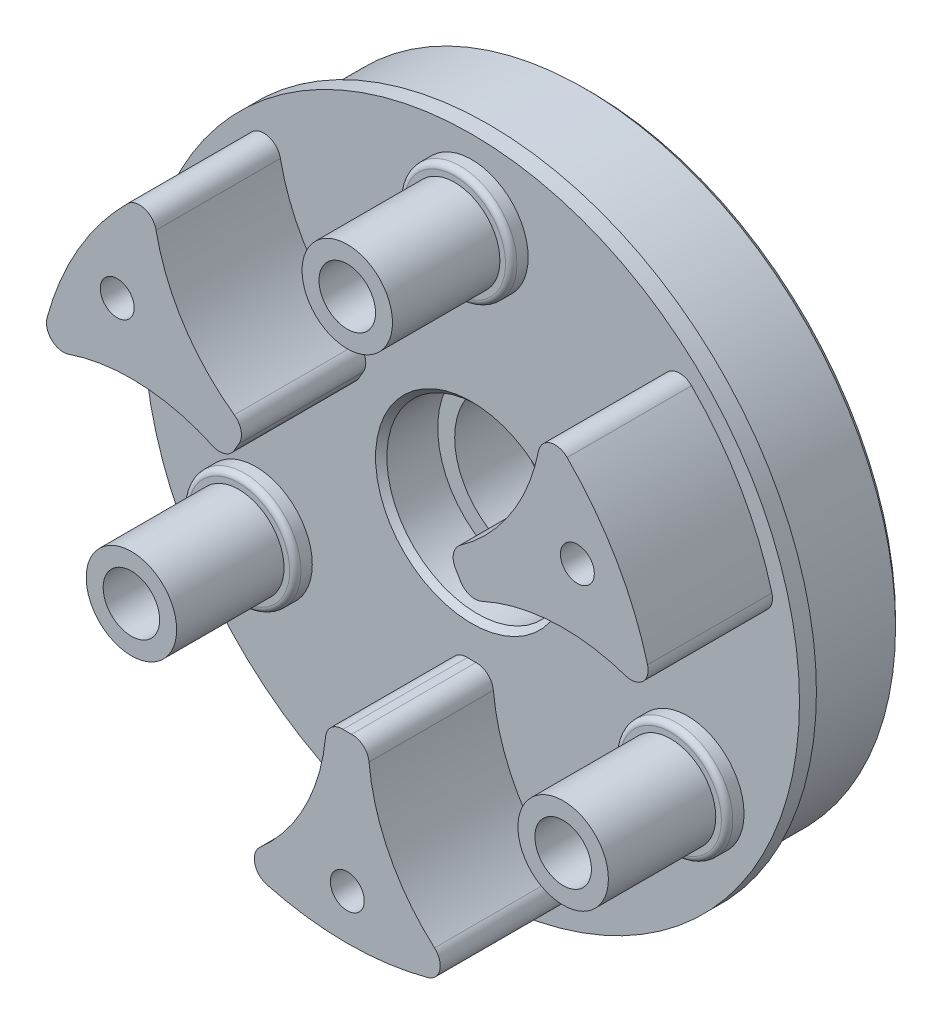
from build123d import *

# Parameters (mm, degrees)
SKETCH1_R                = 27.5
SKETCH1_R_2              = 2.5
BOSS_EXTRUDE1_DEPTH      = 10.5
SKETCH2_R                = 4
SKETCH2_R_2              = 2.5
BOSS_EXTRUDE2_DEPTH      = 11
SKETCH3_R                = 5
SKETCH3_R_2              = 4
BOSS_EXTRUDE3_DEPTH      = 1.5
BOSS_EXTRUDE4_DEPTH      = 11
FILLET2_R                = 0.5
FILLET5_R                = 1.5
CIRPATTERN1_COUNT        = 3
FILLET2_OF_CIRPATTERN1_R = 0.5
FILLET5_OF_CIRPATTERN1_R = 1.5
SKETCH5_R                = 1.5
CUT_EXTRUDE1_DEPTH       = 45.438159278
SKETCH6_R                = 2.75
CUT_EXTRUDE2_DEPTH       = 3
SKETCH7_R                = 4.25
CUT_EXTRUDE3_DEPTH       = 5
CIRPATTERN2_COUNT        = 3
CHAMFER1_SIZE            = 0.5
SKETCH9_R                = 8
CUT_EXTRUDE4_DEPTH       = 41.416580756
BOSS_EXTRUDE7_START      = -5.5
SKETCH10_R               = 8
SKETCH10_R_2             = 6.5
BOSS_EXTRUDE7_DEPTH      = 5.5
CHAMFER2_SIZE            = 0.5
BOSS_EXTRUDE8_START      = -1.5
SKETCH11_R               = 29
SKETCH11_R_2             = 27.5
BOSS_EXTRUDE8_DEPTH      = 1.5


with BuildPart() as part:
    # Sketch1 → Boss-Extrude1 (new body)
    with BuildSketch(Plane.XY):
        with Locations(Location((0, 0, 0), (0, 0, 180))):
            Circle(SKETCH1_R)
        with Locations(Location((0, 22.05, 0), (0, 0, 180))):
            Circle(SKETCH1_R_2, mode=Mode.SUBTRACT)
        with Locations(Location((19.095860153, -11.025, 0), (0, 0, 180))):
            Circle(SKETCH1_R_2, mode=Mode.SUBTRACT)
        with Locations(Location((-19.095860153, -11.025, 0), (0, 0, 180))):
            Circle(SKETCH1_R_2, mode=Mode.SUBTRACT)
    extrude(amount=BOSS_EXTRUDE1_DEPTH)

    # Sketch2 → Boss-Extrude2 (add)
    with BuildSketch(Plane.XY.offset(10.5)):
        with Locations((0, 22.05)):
            Circle(SKETCH2_R)
        with Locations(Location((0, 22.05, 0), (0, 0, 180))):
            Circle(SKETCH2_R_2, mode=Mode.SUBTRACT)
    boss_extrude2 = extrude(amount=BOSS_EXTRUDE2_DEPTH)

    # Sketch3 → Boss-Extrude3 (add)
    with BuildSketch(Plane.XY.offset(10.5)):
        with Locations((0, 22.05)):
            Circle(SKETCH3_R)
        with Locations((0, 22.05)):
            Circle(SKETCH3_R_2, mode=Mode.SUBTRACT)
    boss_extrude3 = extrude(amount=BOSS_EXTRUDE3_DEPTH)

    # Sketch4 → Boss-Extrude4 (add)
    with BuildSketch(Plane.XY.offset(10.5)):
        with BuildLine():
            ThreePointArc((-8.731428479, 7.173015873), (-14.812140242, 13.209015809), (-17.238712835, 21.426077098))
            ThreePointArc((-17.238712835, 21.426077098), (-23.815698604, 13.75), (-27.174883487, 4.216124695))
            ThreePointArc((-27.174883487, 4.216124695), (-18.845413371, 6.223181829), (-10.577728207, 3.975130938))
            ThreePointArc((-10.577728207, 3.975130938), (-9.786087063, 5.65), (-8.731428479, 7.173015873))
        make_face()
    boss_extrude4 = extrude(amount=BOSS_EXTRUDE4_DEPTH)

    # Fillet2
    fillet2_edges = [part.edges().sort_by_distance(p)[0] for p in [
        (-5, 22.05, 12),
    ]]
    fillet(fillet2_edges, radius=FILLET2_R)

    # Fillet5
    # the kernel refuses this fillet: 1.5 mm, written as the material it takes off along each edge
    with BuildSketch(Plane(origin=(-17.238712835, 21.426077098, 10.5), x_dir=(0.11627707658946446, -0.9932168149300573, 0), z_dir=(0, 0, 1))) as fillet5_piece_1:
        with BuildLine():
            CenterArc((2.88996817, -1.495158903), FILLET5_R, 94.604481761, 123.727317632)
            ThreePointArc((1.713319765, -2.425480639), (0.8238966, -1.235883765), (0, 0))
            ThreePointArc((0, 0), (1.384776415, -0.055672613), (2.769552829, 0))
        make_face()
    extrude(amount=18.423956554, mode=Mode.SUBTRACT)
    with BuildSketch(Plane(origin=(-27.174883487, 4.216124695, 10.5), x_dir=(0.9182895314900276, 0.39590950526076735, 0), z_dir=(0, 0, 1))) as fillet5_piece_2:
        with BuildLine():
            CenterArc((2.88996817, 1.495158903), FILLET5_R, 141.668200607, 123.727317632)
            ThreePointArc((1.713319765, 2.425480639), (0.8238966, 1.235883765), (0, 0))
            ThreePointArc((0, 0), (1.384776415, 0.055672613), (2.769552829, 0))
        make_face()
    extrude(amount=18.423956554, mode=Mode.SUBTRACT)
    with BuildSketch(Plane(origin=(-10.577728207, 3.975130938, 10.5), x_dir=(-0.8902885516550605, 0.4553968541743943, 0), z_dir=(0, 0, 1))) as fillet5_piece_3:
        with BuildLine():
            CenterArc((1.570607816, -1.498571769), FILLET5_R, 92.500493645, 86.512353367)
            ThreePointArc((0.070830441, -1.472729442), (0.059461178, -0.735208239), (0, 0))
            ThreePointArc((0, 0), (0.752582912, -0.016424661), (1.505165824, 0))
        make_face()
    extrude(amount=14.762914559, mode=Mode.SUBTRACT)
    with BuildSketch(Plane(origin=(-8.731428479, 7.173015873, 10.5), x_dir=(-0.5830170750372249, -0.8124599006812822, 0), z_dir=(0, 0, 1))) as fillet5_piece_4:
        with BuildLine():
            CenterArc((1.572292256, -1.496804369), FILLET5_R, 93.740653048, 86.512353367)
            ThreePointArc((0.07230688, -1.50342804), (0.052559138, -0.750924993), (0, 0))
            ThreePointArc((0, 0), (0.737215871, -0.024073752), (1.474431742, 0))
        make_face()
    extrude(amount=14.762914559, mode=Mode.SUBTRACT)

    # CirPattern1: Boss-Extrude2, Boss-Extrude3, Boss-Extrude4 ×3 about axis
    cirpattern1_axis = Axis((0, 0, 0), (0, 0, 1))
    add([boss_extrude2.rotate(cirpattern1_axis, i * 360 / CIRPATTERN1_COUNT) for i in range(1, CIRPATTERN1_COUNT)])
    add([boss_extrude3.rotate(cirpattern1_axis, i * 360 / CIRPATTERN1_COUNT) for i in range(1, CIRPATTERN1_COUNT)])
    add([boss_extrude4.rotate(cirpattern1_axis, i * 360 / CIRPATTERN1_COUNT) for i in range(1, CIRPATTERN1_COUNT)])

    # Fillet2 of CirPattern1
    fillet2_of_cirpattern1_edges = [part.edges().sort_by_distance(p)[0] for p in [
        (-16.595860153, -15.355127019, 12),
        (21.595860153, -6.694872981, 12),
    ]]
    fillet(fillet2_of_cirpattern1_edges, radius=FILLET2_OF_CIRPATTERN1_R)

    # Fillet5 of CirPattern1
    # the kernel refuses this fillet: 1.5 mm, written as the material it takes off along each edge
    with BuildSketch(Plane(origin=(-9.936170652, -25.642201793, 10.5), x_dir=(0.950591872836604, -0.31044337856845616, 0), z_dir=(0, 0, 1))) as fillet5_of_cirpattern1_piece_1:
        with BuildLine():
            CenterArc((2.888594005, 1.497812019), FILLET5_OF_CIRPATTERN1_R, 149.367724673, 123.727317632)
            ThreePointArc((1.597911292, 2.262101319), (0.844427641, 1.098929988), (0, 0))
            ThreePointArc((0, 0), (1.484791311, -0.040112987), (2.969582622, 0))
        make_face()
    extrude(amount=18.423956554, mode=Mode.SUBTRACT)
    with BuildSketch(Plane(origin=(9.936170652, -25.642201793, 10.5), x_dir=(-0.9505918728365876, -0.31044337856850573, 0), z_dir=(0, 0, 1))) as fillet5_of_cirpattern1_piece_2:
        with BuildLine():
            CenterArc((2.888594005, -1.497812019), FILLET5_OF_CIRPATTERN1_R, 86.904957695, 123.727317632)
            ThreePointArc((1.597911292, -2.262101319), (0.844427641, -1.098929988), (0, 0))
            ThreePointArc((0, 0), (1.484791311, 0.040112987), (2.969582622, 0))
        make_face()
    extrude(amount=18.423956554, mode=Mode.SUBTRACT)
    with BuildSketch(Plane(origin=(1.846299728, -11.148146811, 10.5), x_dir=(0.050759031308987616, -0.998710929518934, 0), z_dir=(0, 0, 1)), Plane(origin=(8.731428479, 7.173015873, 10.5), x_dir=(0.8395295203460723, 0.5433140753445413, 0), z_dir=(0, 0, 1))) as fillet5_of_cirpattern1_piece_3:
        with BuildLine():
            CenterArc((1.570607816, -1.498571769), FILLET5_OF_CIRPATTERN1_R, 92.500493645, 86.512353367)
            ThreePointArc((0.070830441, -1.472729442), (0.059461178, -0.735208239), (0, 0))
            ThreePointArc((0, 0), (0.752582912, -0.016424661), (1.505165824, 0))
        make_face()
    extrude(amount=14.762914559, mode=Mode.SUBTRACT)
    with BuildSketch(Plane(origin=(-1.846299728, -11.148146811, 10.5), x_dir=(0.9951194510647849, -0.09867764748169308, 0), z_dir=(0, 0, 1)), Plane(origin=(10.577728207, 3.975130938, 10.5), x_dir=(-0.41210237602756, 0.9111375481629761, 0), z_dir=(0, 0, 1))) as fillet5_of_cirpattern1_piece_4:
        with BuildLine():
            CenterArc((1.572292256, -1.496804369), FILLET5_OF_CIRPATTERN1_R, 93.740653048, 86.512353367)
            ThreePointArc((0.07230688, -1.50342804), (0.052559138, -0.750924993), (0, 0))
            ThreePointArc((0, 0), (0.737215871, -0.024073752), (1.474431742, 0))
        make_face()
    extrude(amount=14.762914559, mode=Mode.SUBTRACT)
    with BuildSketch(Plane(origin=(27.174883487, 4.216124695, 10.5), x_dir=(-0.918289531490027, 0.3959095052607686, 0), z_dir=(0, 0, 1))) as fillet5_of_cirpattern1_piece_5:
        with BuildLine():
            CenterArc((2.88996817, -1.495158903), FILLET5_OF_CIRPATTERN1_R, 94.604481761, 123.727317632)
            ThreePointArc((1.713319765, -2.425480639), (0.8238966, -1.235883765), (0, 0))
            ThreePointArc((0, 0), (1.384776415, -0.055672613), (2.769552829, 0))
        make_face()
    extrude(amount=18.423956554, mode=Mode.SUBTRACT)
    with BuildSketch(Plane(origin=(17.238712835, 21.426077098, 10.5), x_dir=(-0.11627707658945366, -0.9932168149300585, 0), z_dir=(0, 0, 1))) as fillet5_of_cirpattern1_piece_6:
        with BuildLine():
            CenterArc((2.88996817, 1.495158903), FILLET5_OF_CIRPATTERN1_R, 141.668200607, 123.727317632)
            ThreePointArc((1.713319765, 2.425480639), (0.8238966, 1.235883765), (0, 0))
            ThreePointArc((0, 0), (1.384776415, 0.055672613), (2.769552829, 0))
        make_face()
    extrude(amount=18.423956554, mode=Mode.SUBTRACT)

    # Sketch5 → Cut-Extrude1 (cut, through all)
    with BuildSketch(Plane.XY.offset(21.5)):
        with Locations((-20.351596989, 11.75)):
            Circle(SKETCH5_R)
    cut_extrude1 = extrude(amount=-CUT_EXTRUDE1_DEPTH, mode=Mode.SUBTRACT)

    # Sketch6 → Cut-Extrude2 (cut)
    with BuildSketch(Plane(origin=(0, 0, 0), x_dir=(-1, 0, 0), z_dir=(0, 0, -1))):
        with Locations((20.351596989, 11.75)):
            Circle(SKETCH6_R)
    cut_extrude2 = extrude(amount=-CUT_EXTRUDE2_DEPTH, mode=Mode.SUBTRACT)

    # Sketch7 → Cut-Extrude3 (cut)
    with BuildSketch(Plane(origin=(0, 0, 0), x_dir=(-1, 0, 0), z_dir=(0, 0, -1))):
        with Locations((0, 22.05)):
            Circle(SKETCH7_R)
    cut_extrude3 = extrude(amount=-CUT_EXTRUDE3_DEPTH, mode=Mode.SUBTRACT)

    # CirPattern2: Cut-Extrude1, Cut-Extrude2, Cut-Extrude3 ×3 about axis
    cirpattern2_axis = Axis((0, 0, 0), (0, 0, 1))
    add([cut_extrude1.rotate(cirpattern2_axis, i * 360 / CIRPATTERN2_COUNT) for i in range(1, CIRPATTERN2_COUNT)], mode=Mode.SUBTRACT)
    add([cut_extrude2.rotate(cirpattern2_axis, i * 360 / CIRPATTERN2_COUNT) for i in range(1, CIRPATTERN2_COUNT)], mode=Mode.SUBTRACT)
    add([cut_extrude3.rotate(cirpattern2_axis, i * 360 / CIRPATTERN2_COUNT) for i in range(1, CIRPATTERN2_COUNT)], mode=Mode.SUBTRACT)

    # Chamfer1
    chamfer1_edges = [part.edges().sort_by_distance(p)[0] for p in [
        (27.5, 0, 0),
    ]]
    chamfer(chamfer1_edges, length=CHAMFER1_SIZE)

    # Sketch9 → Cut-Extrude4 (cut, through all)
    with BuildSketch(Plane.XY.offset(10.5)):
        Circle(SKETCH9_R)
    extrude(amount=-CUT_EXTRUDE4_DEPTH, mode=Mode.SUBTRACT)

    # Sketch10 → Boss-Extrude7 (add)
    with BuildSketch(Plane(origin=(0, 0, 0), x_dir=(-1, 0, 0), z_dir=(0, 0, -1)).offset(BOSS_EXTRUDE7_START)):
        with Locations(Location((0, 0, 0), (0, 0, 180))):
            Circle(SKETCH10_R)
        Circle(SKETCH10_R_2, mode=Mode.SUBTRACT)
    extrude(amount=BOSS_EXTRUDE7_DEPTH)

    # Chamfer2
    chamfer2_edges = [part.edges().sort_by_distance(p)[0] for p in [
        (-8, 0, 10.5),
    ]]
    chamfer(chamfer2_edges, length=CHAMFER2_SIZE)

    # Sketch11 → Boss-Extrude8 (add)
    with BuildSketch(Plane.XY.offset(10.5).offset(BOSS_EXTRUDE8_START)):
        Circle(SKETCH11_R)
        with Locations(Location((0, 0, 0), (0, 0, 180))):
            Circle(SKETCH11_R_2, mode=Mode.SUBTRACT)
    extrude(amount=BOSS_EXTRUDE8_DEPTH)


solid = part.part
